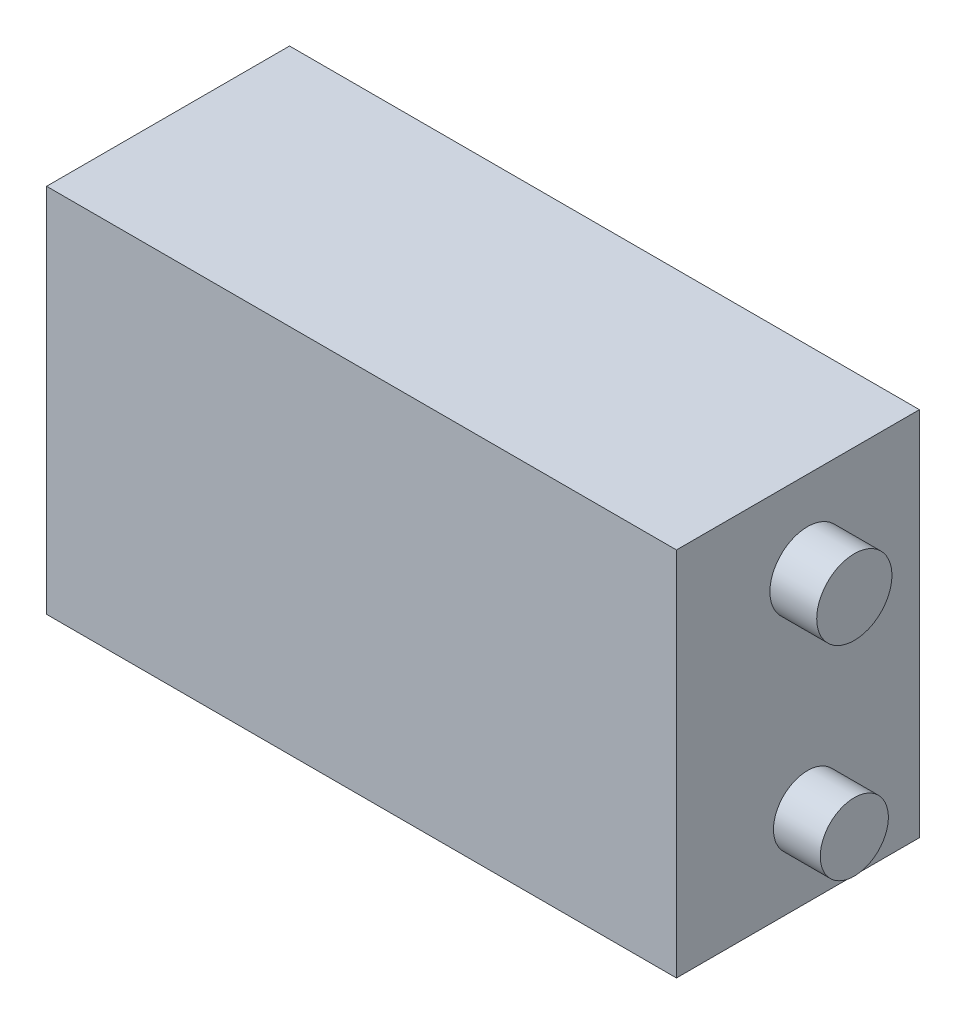
from build123d import *

# Parameters (mm, degrees)
SKETCH1_W           = 44.45
SKETCH1_H           = 26.162
BOSS_EXTRUDE1_DEPTH = 17.145
SKETCH2_R           = 2.653013258
SKETCH2_R_2         = 2.40141023
BOSS_EXTRUDE2_DEPTH = 3.302


with BuildPart() as part:
    # Sketch1 → Boss-Extrude1 (new body)
    with BuildSketch(Plane.XY):
        Rectangle(SKETCH1_W, SKETCH1_H)
    extrude(amount=BOSS_EXTRUDE1_DEPTH)

    # Sketch2 → Boss-Extrude2 (add)
    with BuildSketch(Plane(origin=(22.225, 0, 0), x_dir=(0, 0, -1), z_dir=(1, 0, 0))):
        with Locations((-7.896848557, 7.227034624)):
            Circle(SKETCH2_R)
        with Locations((-7.896848557, -7.428836292)):
            Circle(SKETCH2_R_2)
    extrude(amount=BOSS_EXTRUDE2_DEPTH)


solid = part.part
